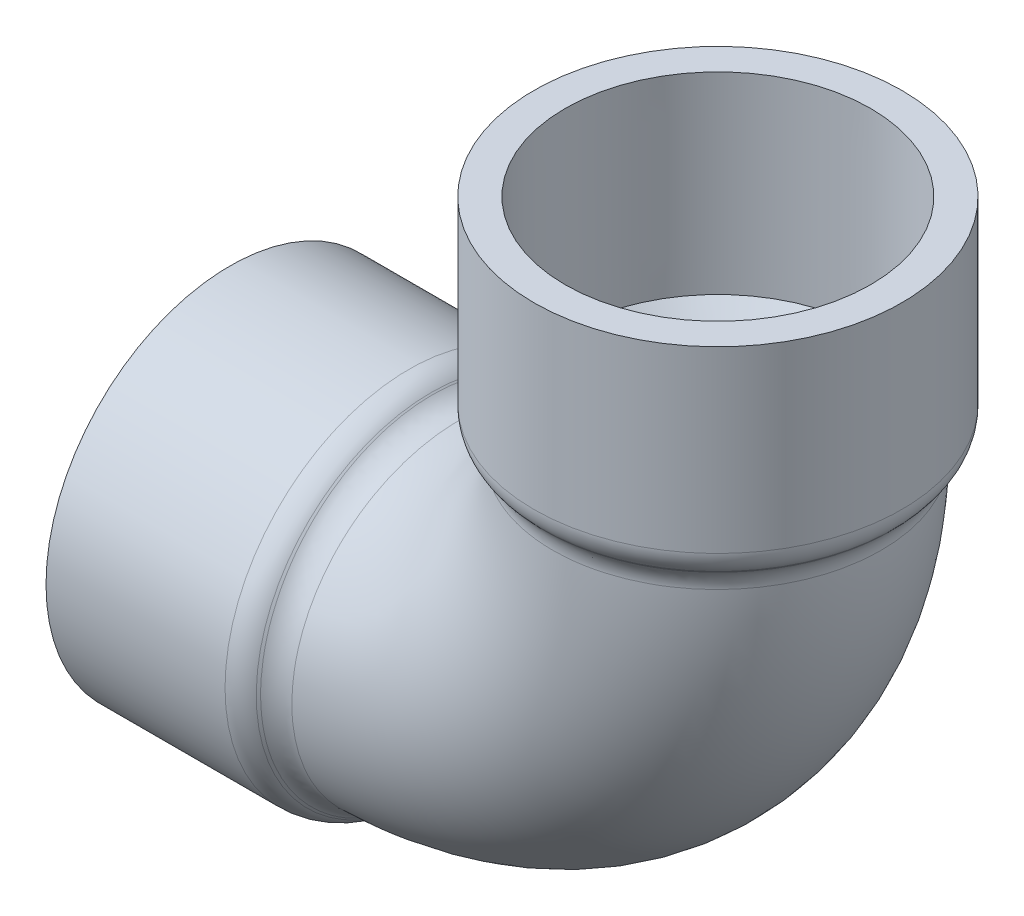
from build123d import *

# Parameters (mm, degrees)
SKETCH3_R   = 32.4485
SKETCH3_R_2 = 26.2509
FILLET1_R   = 6.1976


with BuildPart() as part:
    # Sketch1 → Revolve1 (revolve)
    with BuildSketch(Plane.XY):
        Polygon((-58.7375, -36.5125), (-54.6735, -32.4485), (-54.6735, -26.2509), (-58.7375, -30.0863), (-96.8375, -30.3149), (-96.8375, -36.5125), align=None)
    revolve(axis=Axis((-96.8375, 0, 0), (1, 0, 0)))



with BuildPart() as body_2:
    # Sketch2 → Revolve2 (revolve)
    with BuildSketch(Plane.XY):
        Polygon((30.3149, 96.8375), (30.0863, 58.7375), (26.2509, 54.6735), (32.4485, 54.6735), (36.5125, 58.7375), (36.5125, 96.8375), align=None)
    revolve(axis=Axis((0, 0, 0), (0, 1, 0)))


with BuildPart() as part_1:
    add(part.part)

    add(body_2.part)  # Sweep1 merges body 2
    # Sweep1: sweep along a path in Sketch4
    with BuildLine(Plane.XY) as sweep1_path:
        ThreePointArc((-54.6735, 0), (-16.013497399, 16.013497399), (0, 54.6735))
    # Sketch3 → Sweep1 (sweep)
    with BuildSketch(Plane(origin=(-54.6735, 0, 0), x_dir=(0, 0, -1), z_dir=(1, 0, 0))):
        Circle(SKETCH3_R)
        Circle(SKETCH3_R_2, mode=Mode.SUBTRACT)
    sweep(path=sweep1_path.line)

    # Fillet1
    fillet1_edges = [part_1.edges().sort_by_distance(p)[0] for p in [
        (-54.6735, -22.944554389, -22.944554389),
        (-22.944554389, 54.6735, 22.944554389),
        (-36.5125, 58.7375, 0),
        (-58.7375, 36.5125, 0),
    ]]
    fillet(fillet1_edges, radius=FILLET1_R)


solid = part_1.part
